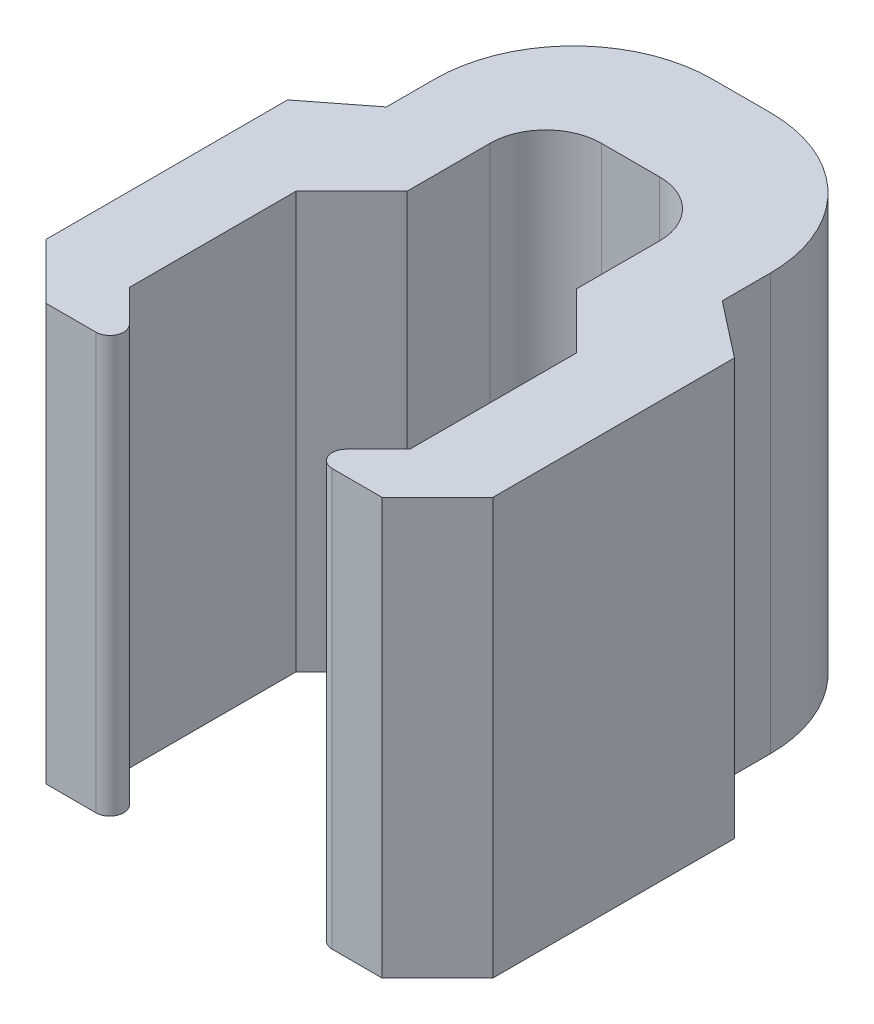
from build123d import *

# Parameters (mm, degrees)
BOSS_EXTRUDE1_DEPTH = 15
CHAMFER1_SIZE       = 2
FILLET1_R           = 2
FILLET3_R           = 5
FILLET4_R           = 0.5


with BuildPart() as part:
    # Sketch2 → Boss-Extrude1 (new body)
    with BuildSketch(Plane(origin=(0, 0, 0), x_dir=(1, 0, 0), z_dir=(0, 1, 0))):
        Polygon((-14.166102689, -0.628958771), (-9.166102689, -0.628958771), (-11.166102689, 1.371041229), (-11.166102689, 7.371041229), (-9.166102689, 9.371041229), (-9.166102689, 14.371041229), (-3.066102689, 14.371041229), (-3.066102689, 9.371041229), (-1.066102689, 7.371041229), (-1.066102689, 1.371041229), (-3.066102689, -0.628958771), (1.933897311, -0.628958771), (1.933897311, 10.071041229), (-0.066102689, 11.631429668), (-0.066102689, 18.371041229), (-12.166102689, 18.371041229), (-12.166102689, 11.631429668), (-14.166102689, 10.071041229), align=None)
    extrude(amount=BOSS_EXTRUDE1_DEPTH)

    # Chamfer1
    chamfer1_edges = [part.edges().sort_by_distance(p)[0] for p in [
        (-14.166102689, 7.5, 0.628958771),
        (1.933897311, 7.5, 0.628958771),
    ]]
    chamfer(chamfer1_edges, length=CHAMFER1_SIZE)

    # Fillet1
    fillet1_edges = [part.edges().sort_by_distance(p)[0] for p in [
        (-3.066102689, 7.5, -14.371041229),
        (-9.166102689, 7.5, -14.371041229),
    ]]
    fillet(fillet1_edges, radius=FILLET1_R)

    # Fillet3
    fillet3_edges = [part.edges().sort_by_distance(p)[0] for p in [
        (-0.066102689, 7.5, -18.371041229),
        (-12.166102689, 7.5, -18.371041229),
    ]]
    fillet(fillet3_edges, radius=FILLET3_R)

    # Fillet4
    fillet4_edges = [part.edges().sort_by_distance(p)[0] for p in [
        (-3.066102689, 7.5, 0.628958771),
        (-9.166102689, 7.5, 0.628958771),
    ]]
    fillet(fillet4_edges, radius=FILLET4_R)


solid = part.part
